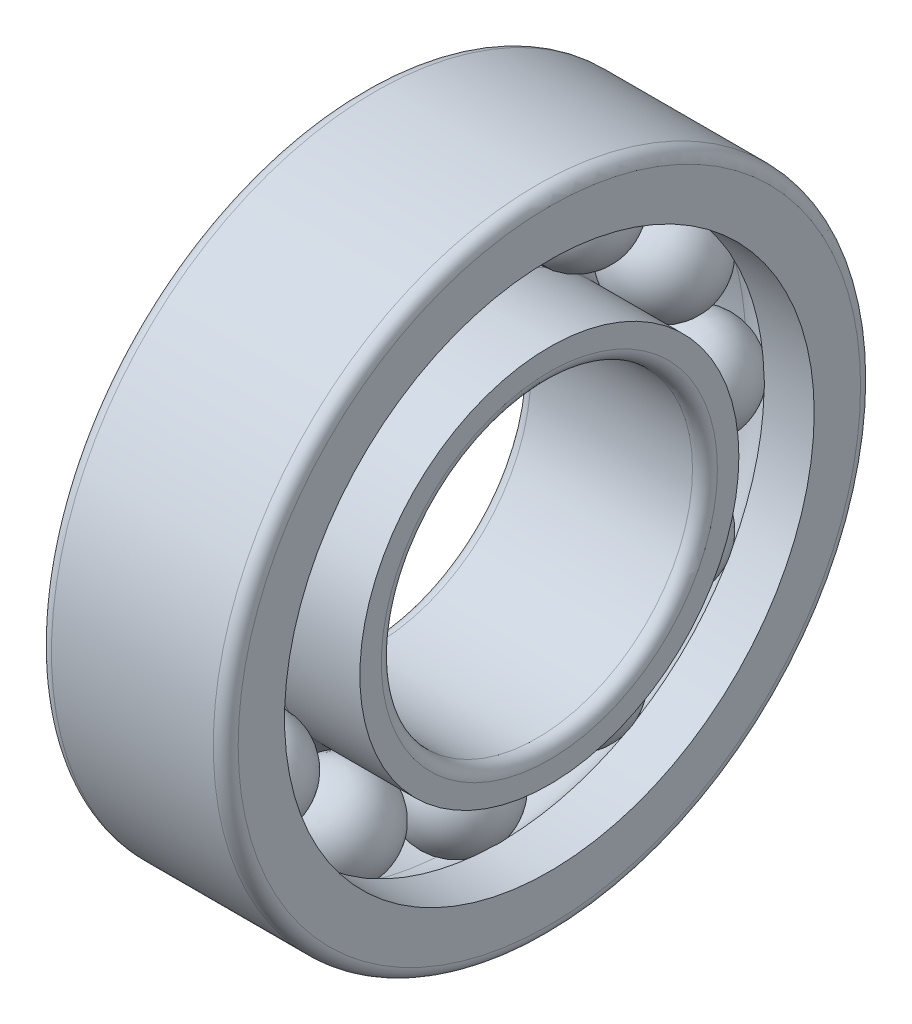
from build123d import *

# Parameters (mm, degrees)
CAGSPISKE_W         = 2.025
CAGSPISKE_H         = 1.35
CAGESPINE_ANGLE     = 0.001
BALLSDETAILED_COUNT = 12
BALLSDETAILED_ANGLE = 330


with BuildPart() as part:
    # CagSpiSke → CageSpine (revolve)
    with BuildSketch(Plane.XY):
        with Locations((0, 19.25)):
            Rectangle(CAGSPISKE_W, CAGSPISKE_H)
    revolve(axis=Axis((-20.6375, 0, 0), (1, 0, 0)), revolution_arc=CAGESPINE_ANGLE)

    # BalDetSke → BallDetailed (revolve)
    with BuildSketch(Plane.XY):
        with BuildLine():
            Line((-4.05, 19.25), (4.05, 19.25))
            ThreePointArc((4.05, 19.25), (0, 15.2), (-4.05, 19.25))
        make_face()
    balldetailed = revolve(axis=Axis((-1.905, 19.25, 0), (1, 0, 0)))

    # InnRacSke → InnerRace (revolve)
    with BuildSketch(Plane.XY):
        with BuildLine():
            Line((-3.478505426, 17.225), (-7.5, 17.225))
            Line((-7.5, 17.225), (-7.5, 13.5))
            ThreePointArc((-7.5, 13.5), (-7.207106781, 12.792893219), (-6.5, 12.5))
            Line((-6.5, 12.5), (6.5, 12.5))
            ThreePointArc((6.5, 12.5), (7.207106781, 12.792893219), (7.5, 13.5))
            Line((7.5, 13.5), (7.5, 15.225))
            Line((7.5, 15.225), (0, 15.225))
            ThreePointArc((0, 15.225), (-2.006240265, 15.760641176), (-3.478505426, 17.225))
        make_face()
    revolve(axis=Axis((-20.6375, 0, 0), (1, 0, 0)))

    # OutRacSke → OuterRace (revolve)
    with BuildSketch(Plane.XY):
        with BuildLine():
            Line((0, 23.275), (-7.5, 23.275))
            Line((-7.5, 23.275), (-7.5, 25))
            ThreePointArc((-7.5, 25), (-7.207106781, 25.707106781), (-6.5, 26))
            Line((-6.5, 26), (6.5, 26))
            ThreePointArc((6.5, 26), (7.207106781, 25.707106781), (7.5, 25))
            Line((7.5, 25), (7.5, 21.275))
            Line((7.5, 21.275), (3.478505426, 21.275))
            ThreePointArc((3.478505426, 21.275), (2.006240265, 22.739358824), (0, 23.275))
        make_face()
    revolve(axis=Axis((-20.6375, 0, 0), (1, 0, 0)))

    # BallsDetailed: BallDetailed ×12 about axis
    ballsdetailed_axis = Axis((-50, 0, 0), (1, 0, 0))
    for i in range(1, BALLSDETAILED_COUNT):
        add(balldetailed.rotate(ballsdetailed_axis, i * BALLSDETAILED_ANGLE / (BALLSDETAILED_COUNT - 1)))


solid = part.part
